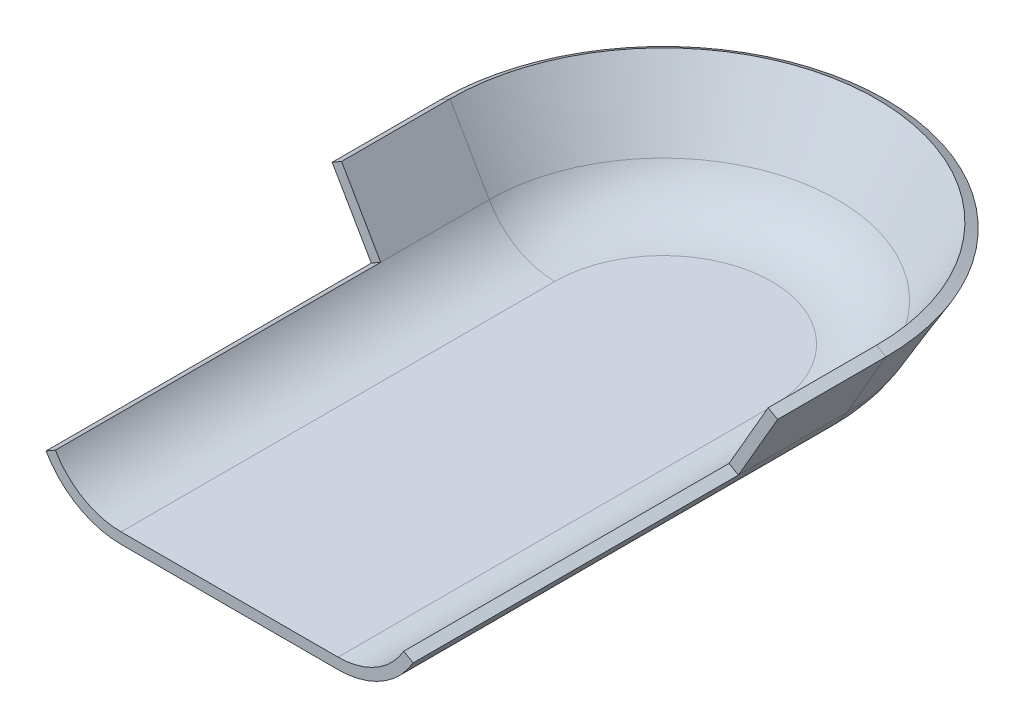
from build123d import *

# Parameters (mm, degrees)
EXTRUDE_THIN1_DEPTH = 38.1
EXTRUDE_THIN2_START = 12.7
EXTRUDE_THIN2_DEPTH = 12.7
REVOLVE_THIN1_ANGLE = 180
EXTRUDE_THIN3_START = -10.16
EXTRUDE_THIN3_DEPTH = 1.27


# Read off the part's stored shape, not the designer's step: Extrude-Thin3
with BuildPart() as part:
    # Sketch1 → Extrude-Thin1 (new body)
    with BuildSketch(Plane.XY):
        with BuildLine():
            ThreePointArc((-8.798818102, -5.08), (-5.08, -8.798818102), (0, -10.16))
            Line((0, -10.16), (25.4, -10.16))
            ThreePointArc((25.4, -10.16), (30.48, -8.798818102), (34.198818102, -5.08))
            Line((34.198818102, -5.08), (33.09896584, -4.445))
            ThreePointArc((33.09896584, -4.445), (29.845, -7.69896584), (25.4, -8.89))
            Line((25.4, -8.89), (0, -8.89))
            ThreePointArc((0, -8.89), (-4.445, -7.69896584), (-7.69896584, -4.445))
            Line((-7.69896584, -4.445), (-8.798818102, -5.08))
        make_face()
    extrude(amount=EXTRUDE_THIN1_DEPTH)

    # Sketch2 → Extrude-Thin2 (add)
    with BuildSketch(Plane(origin=(0, 0, 0), x_dir=(-1, 0, 0), z_dir=(0, 0, -1)).offset(EXTRUDE_THIN2_START)):
        with BuildLine():
            Line((-38.781535864, 2.8575), (-34.198818102, -5.08))
            ThreePointArc((-34.198818102, -5.08), (-30.48, -8.798818102), (-25.4, -10.16))
            Line((-25.4, -10.16), (0, -10.16))
            ThreePointArc((0, -10.16), (5.08, -8.798818102), (8.798818102, -5.08))
            Line((8.798818102, -5.08), (13.381535864, 2.8575))
            Line((13.381535864, 2.8575), (12.281683601, 3.4925))
            Line((12.281683601, 3.4925), (7.69896584, -4.445))
            ThreePointArc((7.69896584, -4.445), (4.445, -7.69896584), (0, -8.89))
            Line((0, -8.89), (-25.4, -8.89))
            ThreePointArc((-25.4, -8.89), (-29.845, -7.69896584), (-33.09896584, -4.445))
            Line((-33.09896584, -4.445), (-37.681683601, 3.4925))
            Line((-37.681683601, 3.4925), (-38.781535864, 2.8575))
        make_face()
    extrude(amount=-EXTRUDE_THIN2_DEPTH)

    # Sketch3 → Revolve-Thin1 (revolve)
    with BuildSketch(Plane(origin=(0, 0, -12.7), x_dir=(-1, 0, 0), z_dir=(0, 0, -1))):
        with BuildLine():
            ThreePointArc((0, -10.16), (5.08, -8.798818102), (8.798818102, -5.08))
            Line((8.798818102, -5.08), (13.381535864, 2.8575))
            Line((13.381535864, 2.8575), (12.281683601, 3.4925))
            Line((12.281683601, 3.4925), (7.69896584, -4.445))
            ThreePointArc((7.69896584, -4.445), (4.445, -7.69896584), (0, -8.89))
            Line((0, -8.89), (0, -10.16))
        make_face()
    revolve(axis=Axis((12.7, -10.16, -12.7), (0, -1, 0)), revolution_arc=REVOLVE_THIN1_ANGLE)

    # Extrude-Thin3 outline → Extrude-Thin3 (add)
    with BuildSketch(Plane(origin=(0, 0, 0), x_dir=(1, 0, 0), z_dir=(0, 1, 0)).offset(EXTRUDE_THIN3_START)):
        with BuildLine():
            Line((0, 12.7), (25.4, 12.7))
            ThreePointArc((25.4, 12.7), (12.7, 25.4), (0, 12.7))
        make_face()
    extrude(amount=EXTRUDE_THIN3_DEPTH)


solid = part.part
